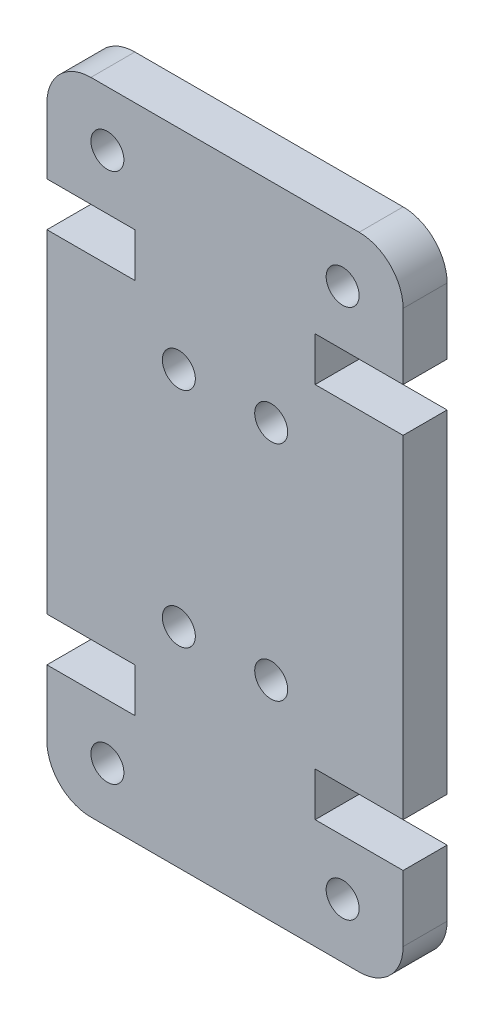
from build123d import *

# Parameters (mm, degrees)
SKETCH1_R           = 0.75
BOSS_EXTRUDE1_DEPTH = 2


with BuildPart() as part:
    # Sketch1 → Boss-Extrude1 (new body)
    with BuildSketch(Plane.XY):
        with BuildLine():
            Line((0, 22.14), (0, 7))
            Line((0, 7), (4, 7))
            Line((4, 7), (4, 5))
            Line((4, 5), (0, 5))
            Line((0, 5), (0, 2))
            ThreePointArc((0, 2), (0.585786438, 0.585786438), (2, 0))
            Line((2, 0), (14.2, 0))
            ThreePointArc((14.2, 0), (15.614213562, 0.585786438), (16.2, 2))
            Line((16.2, 2), (16.2, 5))
            Line((16.2, 5), (12.2, 5))
            Line((12.2, 5), (12.2, 7))
            Line((12.2, 7), (16.2, 7))
            Line((16.2, 7), (16.2, 22.14))
            Line((16.2, 22.14), (12.2, 22.14))
            Line((12.2, 22.14), (12.2, 24.14))
            Line((12.2, 24.14), (16.2, 24.14))
            Line((16.2, 24.14), (16.2, 27.14))
            ThreePointArc((16.2, 27.14), (15.614213562, 28.554213562), (14.2, 29.14))
            Line((14.2, 29.14), (2, 29.14))
            ThreePointArc((2, 29.14), (0.585786438, 28.554213562), (0, 27.14))
            Line((0, 27.14), (0, 24.14))
            Line((0, 24.14), (4, 24.14))
            Line((4, 24.14), (4, 22.14))
            Line((4, 22.14), (0, 22.14))
        make_face()
        with Locations((13.45, 2.5)):
            Circle(SKETCH1_R, mode=Mode.SUBTRACT)
        with Locations((10.2, 9.5)):
            Circle(SKETCH1_R, mode=Mode.SUBTRACT)
        with Locations((2.75, 26.64)):
            Circle(SKETCH1_R, mode=Mode.SUBTRACT)
        with Locations((6, 19.64)):
            Circle(SKETCH1_R, mode=Mode.SUBTRACT)
        with Locations((6, 9.5)):
            Circle(SKETCH1_R, mode=Mode.SUBTRACT)
        with Locations((2.75, 2.5)):
            Circle(SKETCH1_R, mode=Mode.SUBTRACT)
        with Locations((10.2, 19.64)):
            Circle(SKETCH1_R, mode=Mode.SUBTRACT)
        with Locations((13.45, 26.64)):
            Circle(SKETCH1_R, mode=Mode.SUBTRACT)
    extrude(amount=BOSS_EXTRUDE1_DEPTH)


solid = part.part
